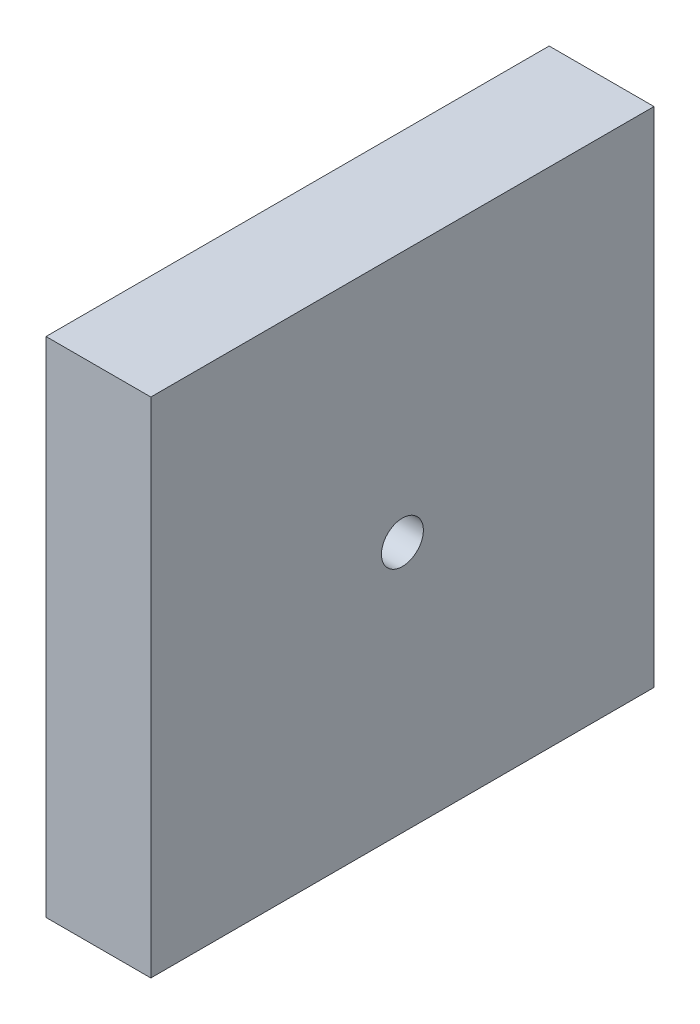
from build123d import *

# Parameters (mm, degrees)
SKETCH2_W           = 96
SKETCH2_H           = 96
SKETCH2_R           = 4
BOSS_EXTRUDE1_DEPTH = 20


with BuildPart() as part:
    # Sketch2 → Boss-Extrude1 (new body)
    with BuildSketch(Plane(origin=(0, 0, 0), x_dir=(0, 0, -1), z_dir=(1, 0, 0))):
        Rectangle(SKETCH2_W, SKETCH2_H)
        Circle(SKETCH2_R, mode=Mode.SUBTRACT)
    extrude(amount=BOSS_EXTRUDE1_DEPTH)


solid = part.part
